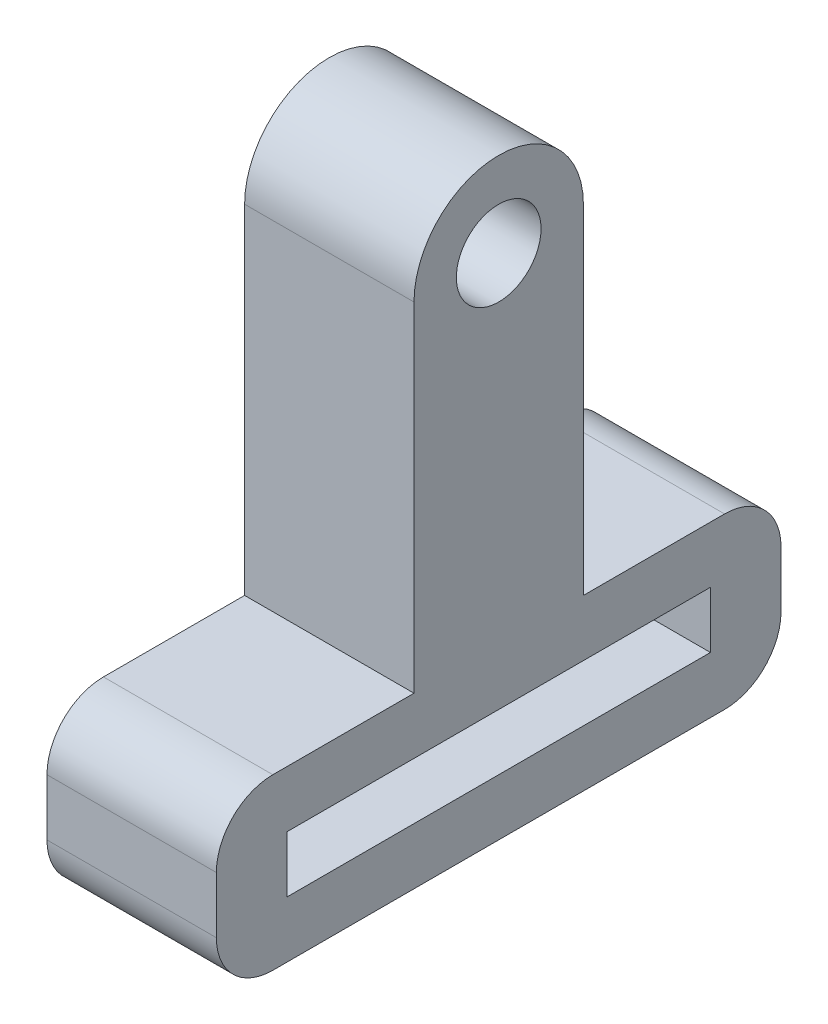
from build123d import *

# Parameters (mm, degrees)
CROQUIS1_R              = 1.5
CROQUIS1_W              = 15
CROQUIS1_H              = 2
SALIENTE_EXTRUIR1_DEPTH = 3


with BuildPart() as part:
    # Croquis1 → Saliente-Extruir1 (new, symmetric)
    with BuildSketch(Plane(origin=(0, 0, 0), x_dir=(0, 0, -1), z_dir=(1, 0, 0))):
        with BuildLine():
            Line((-10, 1), (-10, -1))
            ThreePointArc((-10, -1), (-9.414213562, -2.414213562), (-8, -3))
            Line((-8, -3), (8, -3))
            ThreePointArc((8, -3), (9.414213562, -2.414213562), (10, -1))
            Line((10, -1), (10, 1))
            ThreePointArc((10, 1), (9.414213562, 2.414213562), (8, 3))
            Line((8, 3), (3, 3))
            Line((3, 3), (3, 15))
            ThreePointArc((3, 15), (0, 18), (-3, 15))
            Line((-3, 15), (-3, 3))
            Line((-3, 3), (-8, 3))
            ThreePointArc((-8, 3), (-9.414213562, 2.414213562), (-10, 1))
        make_face()
        with Locations((0, 15)):
            Circle(CROQUIS1_R, mode=Mode.SUBTRACT)
        Rectangle(CROQUIS1_W, CROQUIS1_H, mode=Mode.SUBTRACT)
    extrude(amount=SALIENTE_EXTRUIR1_DEPTH, both=True)


solid = part.part
